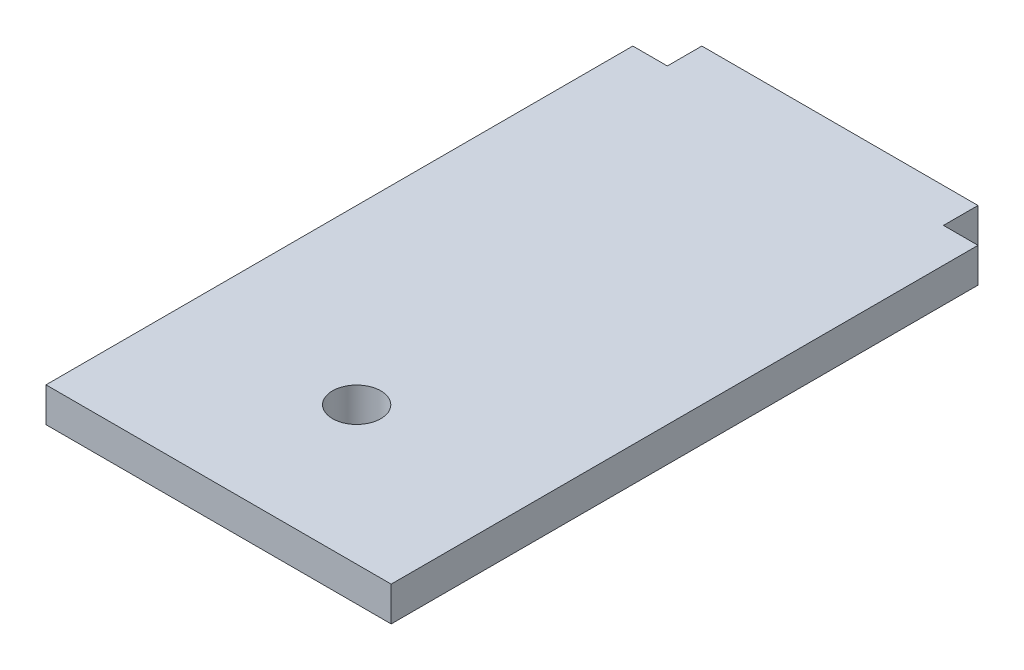
from build123d import *

# Parameters (mm, degrees)
SKETCH1_R           = 3.5
BOSS_EXTRUDE1_DEPTH = 5


with BuildPart() as part:
    # Sketch1 → Boss-Extrude1 (new body)
    with BuildSketch(Plane(origin=(0, 0, 0), x_dir=(1, 0, 0), z_dir=(0, 1, 0))):
        Polygon((0, 85), (5, 85), (5, 90), (45, 90), (45, 85), (50, 85), (50, 0), (0, 0), align=None)
        with Locations((25, 20)):
            Circle(SKETCH1_R, mode=Mode.SUBTRACT)
    extrude(amount=BOSS_EXTRUDE1_DEPTH)


solid = part.part
